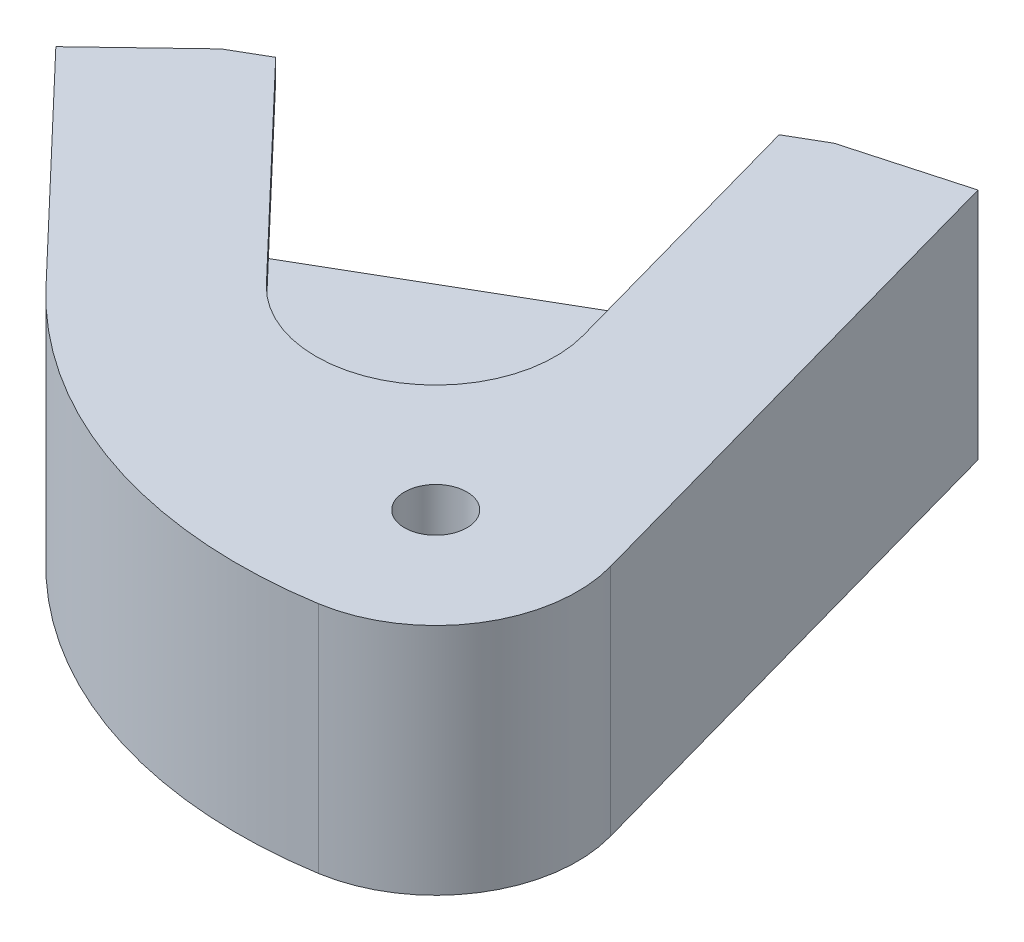
from build123d import *
from build123d.topology import SkipClean

# Parameters (mm, degrees)
SKETCH1_R           = 1.6
BOSS_EXTRUDE1_DEPTH = 6
BOSS_EXTRUDE3_START = 3
SKETCH7_R           = 1.6
BOSS_EXTRUDE3_DEPTH = 3
SKETCH8_R           = 1.6
BOSS_EXTRUDE4_DEPTH = 3
CHAMFER1_SIZE       = 2


with BuildPart() as part:
    # Sketch1 → Boss-Extrude1 (new body)
    with BuildSketch(Plane(origin=(0, 0, 0), x_dir=(1, 0, 0), z_dir=(0, 1, 0))):
        with BuildLine():
            Line((41.864892623, -74.106527494), (52.218230336, -84.960485214))
            ThreePointArc((52.218230336, -84.960485214), (62.095402371, -86.234826865), (65.834966495, -77.004543326))
            Line((65.834966495, -77.004543326), (61.8028085, -62.55664722))
            Line((61.8028085, -62.55664722), (67.581966942, -60.943784022))
            Line((67.581966942, -60.943784022), (74.892595581, -87.138988466))
            ThreePointArc((74.892595581, -87.138988466), (74.014994187, -93.014912457), (69.051034467, -96.279230281))
            ThreePointArc((69.051034467, -96.279230281), (57.637399431, -95.34940583), (47.97440772, -89.204307831))
            Line((47.97440772, -89.204307831), (37.523309535, -78.247862579))
            Line((37.523309535, -78.247862579), (41.864892623, -74.106527494))
        make_face()
        with Locations(Location((67.882250994, -89.09545443, 0), (0, 0, 270))):
            Circle(SKETCH1_R, mode=Mode.SUBTRACT)
    extrude(amount=BOSS_EXTRUDE1_DEPTH)

    # Sketch7 → Boss-Extrude3 (add)
    with SkipClean():  # the faces are left unmerged after this step: merging them gives an invalid solid
        with BuildSketch(Plane.XZ.offset(BOSS_EXTRUDE3_START)):
            with BuildLine():
                Line((37.523309535, 78.247862579), (41.864892623, 74.106527494))
                Line((41.864892623, 74.106527494), (61.8028085, 62.55664722))
                Line((61.8028085, 62.55664722), (67.581966942, 60.943784022))
                Line((67.581966942, 60.943784022), (74.892595581, 87.138988466))
                ThreePointArc((74.892595581, 87.138988466), (74.014994187, 93.014912457), (69.051034467, 96.279230281))
                ThreePointArc((69.051034467, 96.279230281), (57.637399431, 95.34940583), (47.97440772, 89.204307831))
                Line((47.97440772, 89.204307831), (37.523309535, 78.247862579))
            make_face()
            with Locations(Location((67.882250994, 89.09545443, 0), (0, 0, 270))):
                Circle(SKETCH7_R, mode=Mode.SUBTRACT)
            with Locations(Location((57.982756057, 79.195959493, 0), (0, 0, 270))):
                Circle(SKETCH7_R, mode=Mode.SUBTRACT)
        extrude(amount=-BOSS_EXTRUDE3_DEPTH)

    # Sketch8 → Boss-Extrude4 (add)
    with BuildSketch(Plane(origin=(0, 6, 0), x_dir=(1, 0, 0), z_dir=(0, 1, 0))):
        with BuildLine():
            Line((41.864892623, -74.106527494), (37.523309535, -78.247862579))
            Line((37.523309535, -78.247862579), (47.97440772, -89.204307831))
            ThreePointArc((47.97440772, -89.204307831), (57.637399431, -95.34940583), (69.051034467, -96.279230281))
            ThreePointArc((69.051034467, -96.279230281), (74.014994187, -93.014912457), (74.892595581, -87.138988466))
            Line((74.892595581, -87.138988466), (67.581966942, -60.943784022))
            Line((67.581966942, -60.943784022), (61.8028085, -62.55664722))
            Line((61.8028085, -62.55664722), (60.015359325, -63.592102685))
            Line((60.015359325, -63.592102685), (63.908580348, -77.542164392))
            ThreePointArc((63.908580348, -77.542164392), (61.023544246, -84.544233882), (53.530990497, -83.442395075))
            Line((53.530990497, -83.442395075), (43.643121603, -73.076413215))
            Line((43.643121603, -73.076413215), (41.864892623, -74.106527494))
        make_face()
        with Locations(Location((67.882250994, -89.09545443, 0), (0, 0, 90))):
            Circle(SKETCH8_R, mode=Mode.SUBTRACT)
    extrude(amount=BOSS_EXTRUDE4_DEPTH)

    # Chamfer1
    # the kernel refuses this chamfer: 2 mm, written as the material it takes off along each edge
    with BuildSketch(Plane(origin=(53.530990497, 6, 83.442395075), x_dir=(-0.7233236015009538, -0.02749587661058648, 0.689961552755735), z_dir=(-0.6902225142158023, 0, -0.7235971813582588))) as chamfer1_piece_1_section:
        Polygon((CHAMFER1_SIZE * 0.999621916911, CHAMFER1_SIZE * 0.0274958766106), (-CHAMFER1_SIZE * 0.0274958766106, CHAMFER1_SIZE * 0.999621916911), (0, 0), align=None)
    chamfer1_piece_1 = extrude(amount=19.468990959, mode=Mode.PRIVATE)
    chamfer1_piece_1 = split(chamfer1_piece_1, bisect_by=Plane(origin=(47.085687298, 6.664817027, 79.579765809), z_dir=(0.7235971813582587, 0, -0.6902225142158024)), keep=Keep.TOP, mode=Mode.PRIVATE)
    add(chamfer1_piece_1, mode=Mode.SUBTRACT)
    with BuildSketch(Plane(origin=(57.982756057, 6, 79.195959493), x_dir=(0.9631930737538318, 0, -0.26881053303887753), z_dir=(-0.26881053303887753, 0, -0.9631930737538318))) as chamfer1_piece_2_section:
        Polygon((6.152270455 + CHAMFER1_SIZE, 0), (6.152270455, -CHAMFER1_SIZE), (6.152270455, 0), align=None)
    chamfer1_piece_2 = revolve(axis=Axis((57.982756057, 6, 79.195959493), (0, -1, 0)), revolution_arc=151.945773521, mode=Mode.PRIVATE)
    chamfer1_piece_2 = split(chamfer1_piece_2, bisect_by=Plane(origin=(55.289387778, 6.562492794, 88.180143835), z_dir=(0.7235971813582587, 0, -0.6902225142158024)), keep=Keep.TOP, mode=Mode.PRIVATE)
    add(chamfer1_piece_2, mode=Mode.SUBTRACT)
    with BuildSketch(Plane(origin=(58.632768376, 6, 58.638048201), x_dir=(0.9628289067414894, -0.027495876610586514, -0.26870890032227024), z_dir=(0.2688105330388776, 0, 0.9631930737538319))) as chamfer1_piece_3:
        Polygon((CHAMFER1_SIZE * 0.999621916911, CHAMFER1_SIZE * 0.0274958766106), (-CHAMFER1_SIZE * 0.0274958766106, CHAMFER1_SIZE * 0.999621916911), (0, 0), align=None)
    extrude(amount=19.626507609, mode=Mode.SUBTRACT)


solid = part.part
